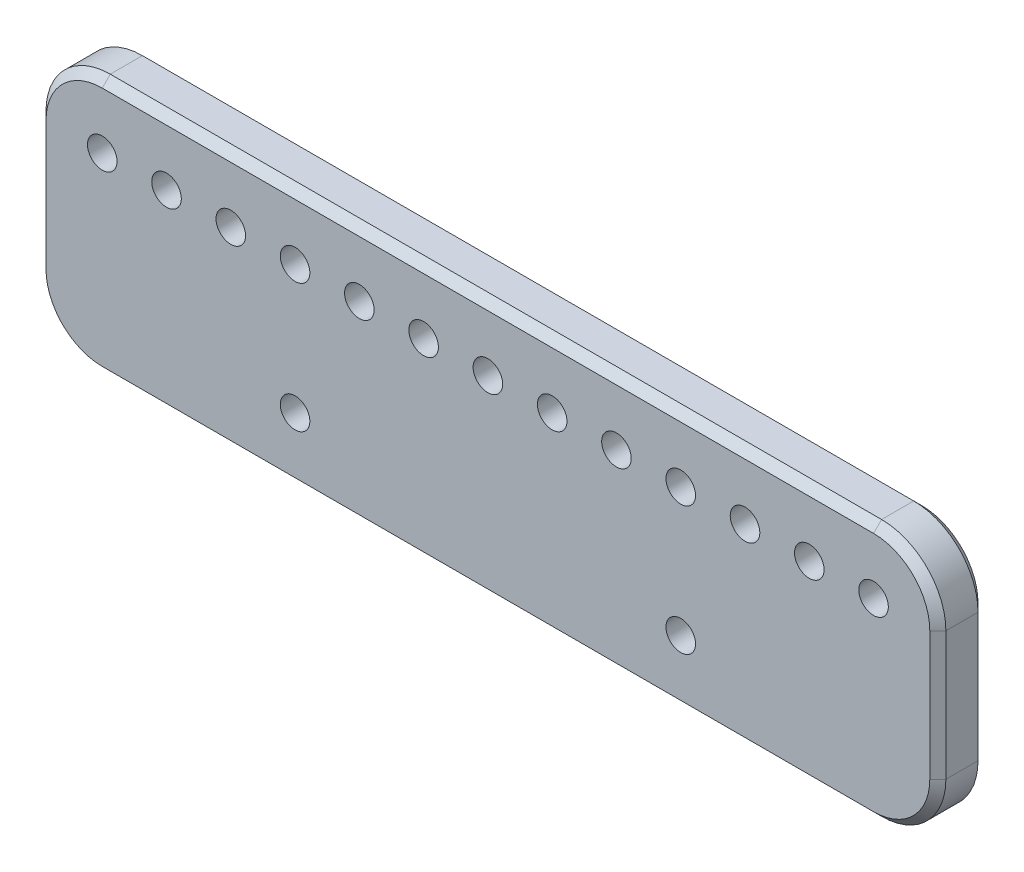
from build123d import *

# Parameters (mm, degrees)
SKETCH1_W           = 177.8
SKETCH1_H           = 50.8
SKETCH1_R           = 2.921
BOSS_EXTRUDE1_DEPTH = 9.525
FILLET1_R           = 12.7
CHAMFER1_SIZE       = 1.5875


with BuildPart() as part:
    # Sketch1 → Boss-Extrude1 (new body)
    with BuildSketch(Plane.XY):
        with Locations((88.9, 25.4)):
            Rectangle(SKETCH1_W, SKETCH1_H)
        with Locations((50.8, 12.7)):
            Circle(SKETCH1_R, mode=Mode.SUBTRACT)
        with Locations((127, 12.7)):
            Circle(SKETCH1_R, mode=Mode.SUBTRACT)
        with Locations((12.7, 38.1)):
            Circle(SKETCH1_R, mode=Mode.SUBTRACT)
        with Locations((25.4, 38.1)):
            Circle(SKETCH1_R, mode=Mode.SUBTRACT)
        with Locations((38.1, 38.1)):
            Circle(SKETCH1_R, mode=Mode.SUBTRACT)
        with Locations((50.8, 38.1)):
            Circle(SKETCH1_R, mode=Mode.SUBTRACT)
        with Locations((63.5, 38.1)):
            Circle(SKETCH1_R, mode=Mode.SUBTRACT)
        with Locations((76.2, 38.1)):
            Circle(SKETCH1_R, mode=Mode.SUBTRACT)
        with Locations((88.9, 38.1)):
            Circle(SKETCH1_R, mode=Mode.SUBTRACT)
        with Locations((101.6, 38.1)):
            Circle(SKETCH1_R, mode=Mode.SUBTRACT)
        with Locations((114.3, 38.1)):
            Circle(SKETCH1_R, mode=Mode.SUBTRACT)
        with Locations((127, 38.1)):
            Circle(SKETCH1_R, mode=Mode.SUBTRACT)
        with Locations((139.7, 38.1)):
            Circle(SKETCH1_R, mode=Mode.SUBTRACT)
        with Locations((152.4, 38.1)):
            Circle(SKETCH1_R, mode=Mode.SUBTRACT)
        with Locations((165.1, 38.1)):
            Circle(SKETCH1_R, mode=Mode.SUBTRACT)
    extrude(amount=BOSS_EXTRUDE1_DEPTH)

    # Fillet1
    fillet1_edges = [part.edges().sort_by_distance(p)[0] for p in [
        (0, 0, 4.7625),
        (0, 50.8, 4.7625),
        (177.8, 0, 4.7625),
        (177.8, 50.8, 4.7625),
    ]]
    fillet(fillet1_edges, radius=FILLET1_R)

    # Chamfer1
    chamfer1_edges = [part.edges().sort_by_distance(p)[0] for p in [
        (0, 25.4, 0),
        (3.719743879, 3.719743879, 0),
        (88.9, 0, 0),
        (3.719743879, 47.080256121, 0),
        (174.080256121, 3.719743879, 0),
        (177.8, 25.4, 0),
        (88.9, 50.8, 0),
        (174.080256121, 47.080256121, 0),
        (174.080256121, 47.080256121, 9.525),
        (177.8, 25.4, 9.525),
        (174.080256121, 3.719743879, 9.525),
        (88.9, 0, 9.525),
        (3.719743879, 3.719743879, 9.525),
        (0, 25.4, 9.525),
        (3.719743879, 47.080256121, 9.525),
        (88.9, 50.8, 9.525),
    ]]
    chamfer(chamfer1_edges, length=CHAMFER1_SIZE)


solid = part.part
